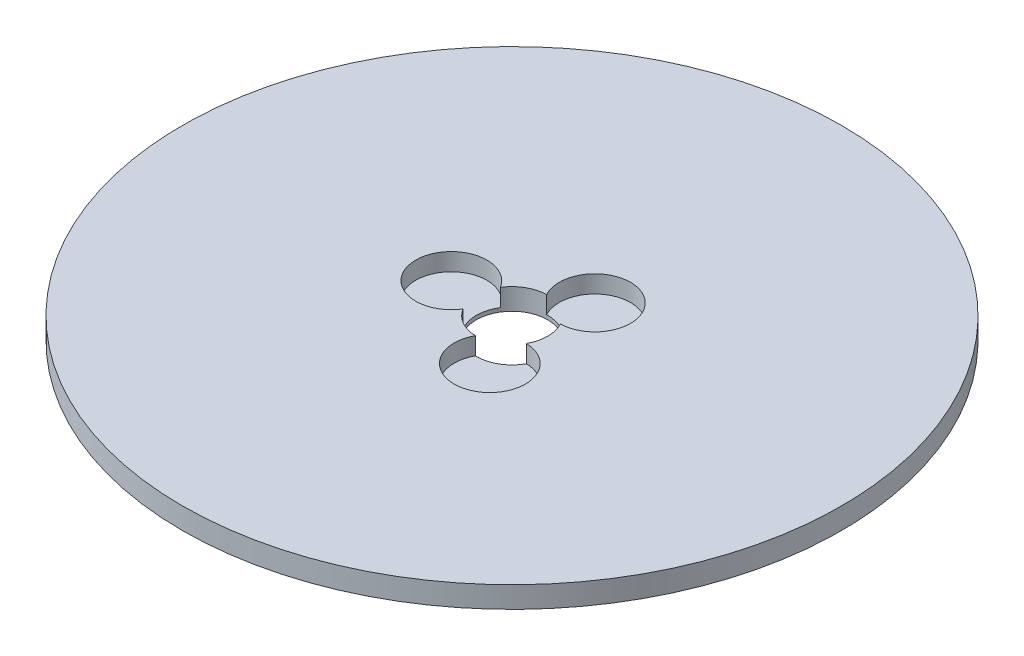
from build123d import *

# Parameters (mm, degrees)
SKETCH1_R           = 92.5
BOSS_EXTRUDE1_DEPTH = 6
SKETCH2_R           = 10
CUT_EXTRUDE1_DEPTH  = 131.952281385
SKETCH3_R           = 10
CUT_EXTRUDE2_DEPTH  = 4.914853976
CIRPATTERN1_COUNT   = 3


with BuildPart() as part:
    # Sketch1 → Boss-Extrude1 (new body)
    with BuildSketch(Plane(origin=(0, 0, 0), x_dir=(1, 0, 0), z_dir=(0, 1, 0))):
        Circle(SKETCH1_R)
    extrude(amount=BOSS_EXTRUDE1_DEPTH)

    # Sketch2 → Cut-Extrude1 (cut, through all)
    with BuildSketch(Plane(origin=(0, 0, 0), x_dir=(1, 0, 0), z_dir=(0, 1, 0))):
        Circle(SKETCH2_R)
    extrude(amount=CUT_EXTRUDE1_DEPTH, mode=Mode.SUBTRACT)

    # Sketch3 → Cut-Extrude2 (cut)
    with BuildSketch(Plane(origin=(0, 6, 0), x_dir=(1, 0, 0), z_dir=(0, 1, 0))):
        with Locations((-17.029651364, 0)):
            Circle(SKETCH3_R)
    cut_extrude2 = extrude(amount=-CUT_EXTRUDE2_DEPTH, mode=Mode.SUBTRACT)

    # CirPattern1: Cut-Extrude2 ×3 about axis
    cirpattern1_axis = Axis((0, 0, 0), (0, 1, 0))
    for i in range(1, CIRPATTERN1_COUNT):
        add(cut_extrude2.rotate(cirpattern1_axis, i * 360 / CIRPATTERN1_COUNT), mode=Mode.SUBTRACT)


solid = part.part
